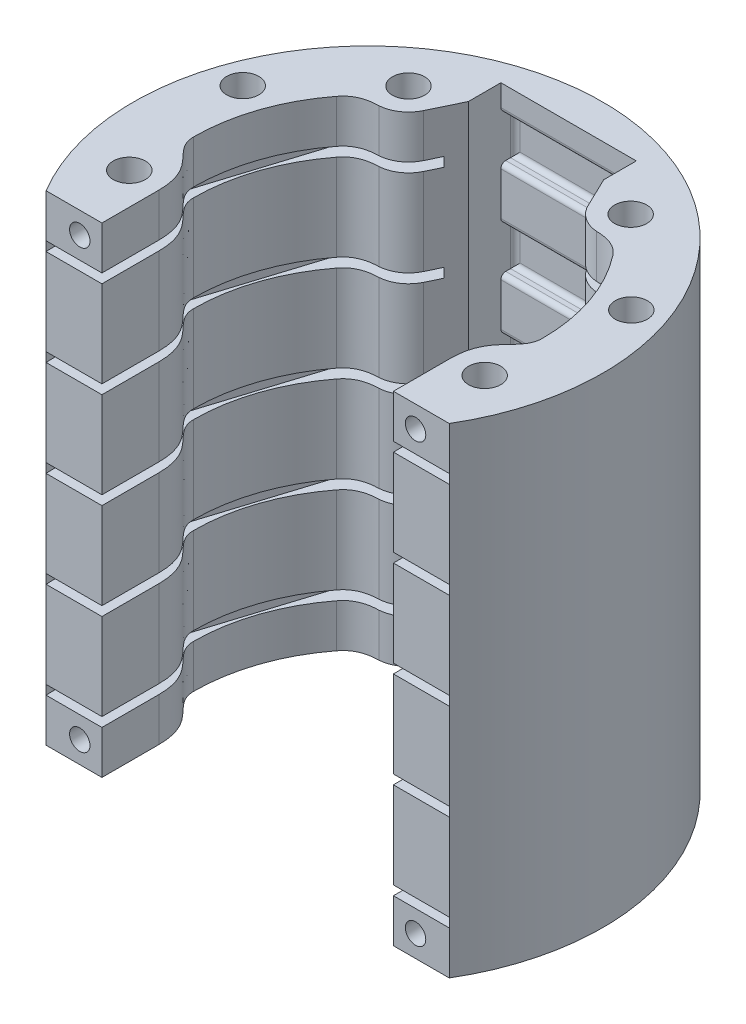
from build123d import *

# Parameters (mm, degrees)
SKETCH1_R               = 3.35
BOSS_EXTRUDE2_DEPTH     = 100
SLOT_DEPTH              = 0.975
SKETCH2_W               = 28.2
SKETCH2_H               = 9.048762348
CUT_EXTRUDE1_DEPTH      = 3
FILLET1_R               = 1
LPATTERN1_COUNT         = 5
LPATTERN1_PITCH         = 20
FILLET1_OF_LPATTERN1_R  = 1
SKETCH7_R               = 2.125
CUT_EXTRUDE2_DEPTH      = 8
MIRROR2_COPY_1_SKETCH_R = 2.125
MIRROR2_COPY_1_DEPTH    = 8


with BuildPart() as part:
    # Sketch1 → Boss-Extrude2 (new body)
    with BuildSketch(Plane(origin=(0, 0, 0), x_dir=(1, 0, 0), z_dir=(0, 1, 0))):
        with BuildLine():
            Line((-41.978758021, -25.07), (-30.348758021, -25.07))
            Line((-30.348758021, -25.07), (-30.348758021, -13.232808954))
            add(Edge.make_bspline(
                [(-30.348758021, -13.232808954), (-30.348758021, -4.818714921), (-36.33, -4.744134389), (-36.33, 0)],
                knots=[0, 0, 0, 0, 1, 1, 1, 1], degree=3))
            ThreePointArc((-36.33, 0), (-34.39042699, 11.711850043), (-28.778806418, 22.173163986))
            add(Edge.make_bspline(
                [(-28.778806418, 22.173163986), (-26.803037595, 24.859102931), (-22.681011433, 24.921676571)],
                knots=[0, 0, 0, 1, 1, 1], degree=2))
            ThreePointArc((-22.681011433, 24.921676571), (-19.402847958, 26.048993856), (-17.137442499, 28.672948531))
            Line((-17.137442499, 28.672948531), (-14.1, 34.984991814))
            Line((-14.1, 34.984991814), (-14.1, 41.76))
            Line((-14.1, 41.76), (14.1, 41.76))
            Line((14.1, 41.76), (14.1, 34.984991814))
            Line((14.1, 34.984991814), (17.137442499, 28.672948531))
            ThreePointArc((17.137442499, 28.672948531), (19.402847958, 26.048993856), (22.681011433, 24.921676571))
            add(Edge.make_bspline(
                [(28.778806418, 22.173163986), (26.803037595, 24.859102931), (22.681011433, 24.921676571)],
                knots=[0, 0, 0, 1, 1, 1], degree=2))
            ThreePointArc((28.778806418, 22.173163986), (34.39042699, 11.711850043), (36.33, 0))
            add(Edge.make_bspline(
                [(30.348758021, -13.232808954), (30.348758021, -4.818714921), (36.33, -4.744134389), (36.33, 0)],
                knots=[0, 0, 0, 0, 1, 1, 1, 1], degree=3))
            Line((30.348758021, -13.232808954), (30.348758021, -25.07))
            Line((30.348758021, -25.07), (41.978758021, -25.07))
            ThreePointArc((41.978758021, -25.07), (0, 48.895), (-41.978758021, -25.07))
        make_face()
        with Locations((-37.000474826, -12.718618748)):
            Circle(SKETCH1_R, mode=Mode.SUBTRACT)
        with Locations((37.000474826, -12.718618748)):
            Circle(SKETCH1_R, mode=Mode.SUBTRACT)
        with Locations((-40.457027923, 14.360145949)):
            Circle(SKETCH1_R, mode=Mode.SUBTRACT)
        with Locations((-23.129730363, 31.556520301)):
            Circle(SKETCH1_R, mode=Mode.SUBTRACT)
        with Locations((40.457027923, 14.360145949)):
            Circle(SKETCH1_R, mode=Mode.SUBTRACT)
        with Locations((23.129730363, 31.556520301)):
            Circle(SKETCH1_R, mode=Mode.SUBTRACT)
    extrude(amount=BOSS_EXTRUDE2_DEPTH)

    # Sketch6 → slot (cut, symmetric)
    with BuildSketch(Plane(origin=(0, 10, 0), x_dir=(-1, 0, 0), z_dir=(0, -1, 0))):
        with BuildLine():
            Line((41.978758021, -25.07), (42.348021617, -12.880616636))
            ThreePointArc((42.348021617, -12.880616636), (42.300596018, -11.989773536), (42.105800179, -11.119196027))
            Line((42.105800179, -11.119196027), (28.235055716, 33.155943022))
            ThreePointArc((28.235055716, 33.155943022), (24.341289072, 36.767530328), (19.253636812, 35.244120983))
            Line((19.253636812, 35.244120983), (13.047964359, 28.721243631))
            ThreePointArc((13.047964359, 28.721243631), (12.816725989, 28.560405037), (12.540811932, 28.50373344))
            Line((12.540811932, 28.50373344), (10.657647051, 28.50373344))
            ThreePointArc((10.657647051, 28.50373344), (10.516225695, 28.562312083), (10.457647051, 28.70373344))
            Line((10.457647051, 28.70373344), (10.457647051, 36.268969967))
            Line((10.457647051, 36.268969967), (9.766617018, 36.96))
            Line((9.766617018, 36.96), (-0.68191112, 36.96))
            Line((-0.68191112, 36.96), (-1.357647051, 36.284264069))
            Line((-1.357647051, 36.284264069), (-1.357647051, 29.218375638))
            ThreePointArc((-1.357647051, 29.218375638), (-2.007647051, 28.607259567), (-2.657647051, 29.218375638))
            Line((-2.657647051, 29.218375638), (-2.657647051, 36.284264069))
            Line((-2.657647051, 36.284264069), (-3.333382982, 36.96))
            Line((-3.333382982, 36.96), (-9.78191112, 36.96))
            Line((-9.78191112, 36.96), (-10.457647051, 36.284264069))
            Line((-10.457647051, 36.284264069), (-10.457647051, 28.70373344))
            ThreePointArc((-10.457647051, 28.70373344), (-10.516225695, 28.562312083), (-10.657647051, 28.50373344))
            Line((-10.657647051, 28.50373344), (-12.540811932, 28.50373344))
            ThreePointArc((-12.540811932, 28.50373344), (-12.816725989, 28.560405037), (-13.047964359, 28.721243631))
            Line((-13.047964359, 28.721243631), (-19.253636812, 35.244120983))
            ThreePointArc((-19.253636812, 35.244120983), (-24.341289072, 36.767530328), (-28.235055716, 33.155943022))
            Line((-28.235055716, 33.155943022), (-42.105800179, -11.119196027))
            ThreePointArc((-42.105800179, -11.119196027), (-42.300596018, -11.989773536), (-42.348021617, -12.880616636))
            Line((-42.348021617, -12.880616636), (-41.978758021, -25.07))
            Line((-41.978758021, -25.07), (41.978758021, -25.07))
        make_face()
    slot = extrude(amount=SLOT_DEPTH, both=True, mode=Mode.SUBTRACT)

    # Sketch2 → Cut-Extrude1 (cut)
    with BuildSketch(Plane.XY.offset(-41.76)):
        with Locations((0, 10)):
            Rectangle(SKETCH2_W, SKETCH2_H)
    cut_extrude1 = extrude(amount=-CUT_EXTRUDE1_DEPTH, mode=Mode.SUBTRACT)

    # Fillet1
    fillet1_edges = [part.edges().sort_by_distance(p)[0] for p in [
        (0, 14.524381174, -44.76),
        (14.1, 10, -44.76),
        (0, 5.475618826, -44.76),
        (-14.1, 10, -44.76),
        (0, 5.475618826, -41.76),
        (0, 14.524381174, -41.76),
    ]]
    fillet(fillet1_edges, radius=FILLET1_R)

    # LPattern1: slot, Cut-Extrude1 ×5
    with Locations(*[(0, i * LPATTERN1_PITCH, 0) for i in range(1, LPATTERN1_COUNT)]):
        add(slot, mode=Mode.SUBTRACT)
        add(cut_extrude1, mode=Mode.SUBTRACT)

    # Fillet1 of LPattern1
    fillet1_of_lpattern1_edges = [part.edges().sort_by_distance(p)[0] for p in [
        (0, 34.524381174, -44.76),
        (14.1, 30, -44.76),
        (0, 25.475618826, -44.76),
        (-14.1, 30, -44.76),
        (0, 25.475618826, -41.76),
        (0, 34.524381174, -41.76),
        (0, 54.524381174, -44.76),
        (14.1, 50, -44.76),
        (0, 45.475618826, -44.76),
        (-14.1, 50, -44.76),
        (0, 45.475618826, -41.76),
        (0, 54.524381174, -41.76),
        (0, 74.524381174, -44.76),
        (14.1, 70, -44.76),
        (0, 65.475618826, -44.76),
        (-14.1, 70, -44.76),
        (0, 65.475618826, -41.76),
        (0, 74.524381174, -41.76),
        (0, 94.524381174, -44.76),
        (14.1, 90, -44.76),
        (0, 85.475618826, -44.76),
        (-14.1, 90, -44.76),
        (0, 85.475618826, -41.76),
        (0, 94.524381174, -41.76),
    ]]
    fillet(fillet1_of_lpattern1_edges, radius=FILLET1_OF_LPATTERN1_R)

    # Sketch7 → Cut-Extrude2 (cut)
    with BuildSketch(Plane.XY.offset(25.07)):
        with Locations((34.962080117, 4.5125)):
            Circle(SKETCH7_R)
    cut_extrude2 = extrude(amount=-CUT_EXTRUDE2_DEPTH, mode=Mode.SUBTRACT)

    # Mirror1: Cut-Extrude2 across plane
    add(cut_extrude2.mirror(Plane(origin=(0, 0, 0), x_dir=(0, 0, 1), z_dir=(1, 0, 0))), mode=Mode.SUBTRACT)

    # Mirror2: Cut-Extrude2 across plane
    add(cut_extrude2.mirror(Plane(origin=(0, 50, 0), x_dir=(0, 0, 1), z_dir=(0, -1, 0))), mode=Mode.SUBTRACT)

    # Mirror2 copy 1 sketch → Mirror2 copy 1 (cut)
    with BuildSketch(Plane(origin=(0, 100, 25.07), x_dir=(-1, 0, 0), z_dir=(0, 0, 1))):
        with Locations((34.962080117, 4.5125)):
            Circle(MIRROR2_COPY_1_SKETCH_R)
    extrude(amount=-MIRROR2_COPY_1_DEPTH, mode=Mode.SUBTRACT)


solid = part.part
